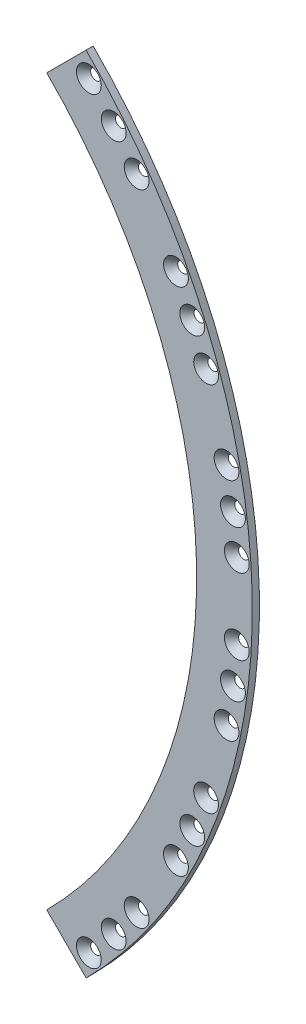
from build123d import *

# Parameters (mm, degrees)
SKETCH1_R           = 1.5
BOSS_EXTRUDE1_DEPTH = 2
CUT_EXTRUDE1_DEPTH  = 197.459257863
CHAMFER1_SIZE       = 2


with BuildPart() as part:
    # Sketch1 → Boss-Extrude1 (new body)
    with BuildSketch(Plane.XY):
        with BuildLine():
            Line((102.318351238, 102.318351238), (113.419927702, 113.419927702))
            ThreePointArc((113.419927702, 113.419927702), (160.4, 0), (113.419927702, -113.419927702))
            Line((113.419927702, -113.419927702), (102.318351238, -102.318351238))
            ThreePointArc((102.318351238, -102.318351238), (144.7, 0), (102.318351238, 102.318351238))
        make_face()
        with Locations((121.321245866, 98.702154493)):
            Circle(SKETCH1_R, mode=Mode.SUBTRACT)
        with Locations((143.451847555, 62.309930452)):
            Circle(SKETCH1_R, mode=Mode.SUBTRACT)
        with Locations((154.94328196, 21.296463919)):
            Circle(SKETCH1_R, mode=Mode.SUBTRACT)
        with Locations((154.94328196, -21.296463919)):
            Circle(SKETCH1_R, mode=Mode.SUBTRACT)
        with Locations((143.451847555, -62.309930452)):
            Circle(SKETCH1_R, mode=Mode.SUBTRACT)
        with Locations((121.321245866, -98.702154493)):
            Circle(SKETCH1_R, mode=Mode.SUBTRACT)
        with Locations(Location((127.774091267, 90.192802379, 0), (0, 0, 180))):
            Circle(SKETCH1_R, mode=Mode.SUBTRACT)
        with Locations(Location((147.369608219, 52.375171344, 0), (0, 0, 180))):
            Circle(SKETCH1_R, mode=Mode.SUBTRACT)
        with Locations(Location((153.128751314, 31.820520441, 0), (0, 0, 180))):
            Circle(SKETCH1_R, mode=Mode.SUBTRACT)
        with Locations(Location((156.035395501, 10.67311345, 0), (0, 0, 180))):
            Circle(SKETCH1_R, mode=Mode.SUBTRACT)
        with Locations(Location((127.774091267, -90.192802379, 0), (0, 0, 180))):
            Circle(SKETCH1_R, mode=Mode.SUBTRACT)
        with Locations(Location((147.369608219, -52.375171344, 0), (0, 0, 180))):
            Circle(SKETCH1_R, mode=Mode.SUBTRACT)
        with Locations(Location((153.128751314, -31.820520441, 0), (0, 0, 180))):
            Circle(SKETCH1_R, mode=Mode.SUBTRACT)
        with Locations(Location((156.035395501, -10.67311345, 0), (0, 0, 180))):
            Circle(SKETCH1_R, mode=Mode.SUBTRACT)
        with Locations((138.865248158, 71.954171901)):
            Circle(SKETCH1_R, mode=Mode.SUBTRACT)
        with Locations((114.302744813, 106.751311599)):
            Circle(SKETCH1_R, mode=Mode.SUBTRACT)
        with Locations((138.865248158, -71.954171901)):
            Circle(SKETCH1_R, mode=Mode.SUBTRACT)
        with Locations((114.302744813, -106.751311599)):
            Circle(SKETCH1_R, mode=Mode.SUBTRACT)
    extrude(amount=BOSS_EXTRUDE1_DEPTH)

    # Sketch2 → Cut-Extrude1 (cut, through all)
    with BuildSketch(Plane.XY.offset(2)):
        Polygon((117.10590357, 116.893771535), (92.696291985, 92.484159951), (81.614099529, 103.566352407), (106.023711114, 127.975963992), align=None)
        Polygon((94.953094668, -94.740962634), (127.588403443, -127.376271408), (106.110382849, -148.854292002), (73.475074075, -116.218983227), align=None)
    extrude(amount=-CUT_EXTRUDE1_DEPTH, mode=Mode.SUBTRACT)

    # Chamfer1
    chamfer1_edges = [part.edges().sort_by_distance(p)[0] for p in [
        (119.821245866, 98.702154493, 2),
        (141.951847555, 62.309930452, 2),
        (153.44328196, 21.296463919, 2),
        (153.44328196, -21.296463919, 2),
        (141.951847555, -62.309930452, 2),
        (119.821245866, -98.702154493, 2),
        (129.274091267, 90.192802379, 2),
        (148.869608219, 52.375171344, 2),
        (154.628751314, 31.820520441, 2),
        (157.535395501, 10.67311345, 2),
        (129.274091267, -90.192802379, 2),
        (148.869608219, -52.375171344, 2),
        (154.628751314, -31.820520441, 2),
        (157.535395501, -10.67311345, 2),
        (112.802744813, 106.751311599, 2),
        (137.365248158, 71.954171901, 2),
        (137.365248158, -71.954171901, 2),
        (112.802744813, -106.751311599, 2),
    ]]
    chamfer(chamfer1_edges, length=CHAMFER1_SIZE - 0.0001)  # a hair under: the kernel refuses the full size


solid = part.part
